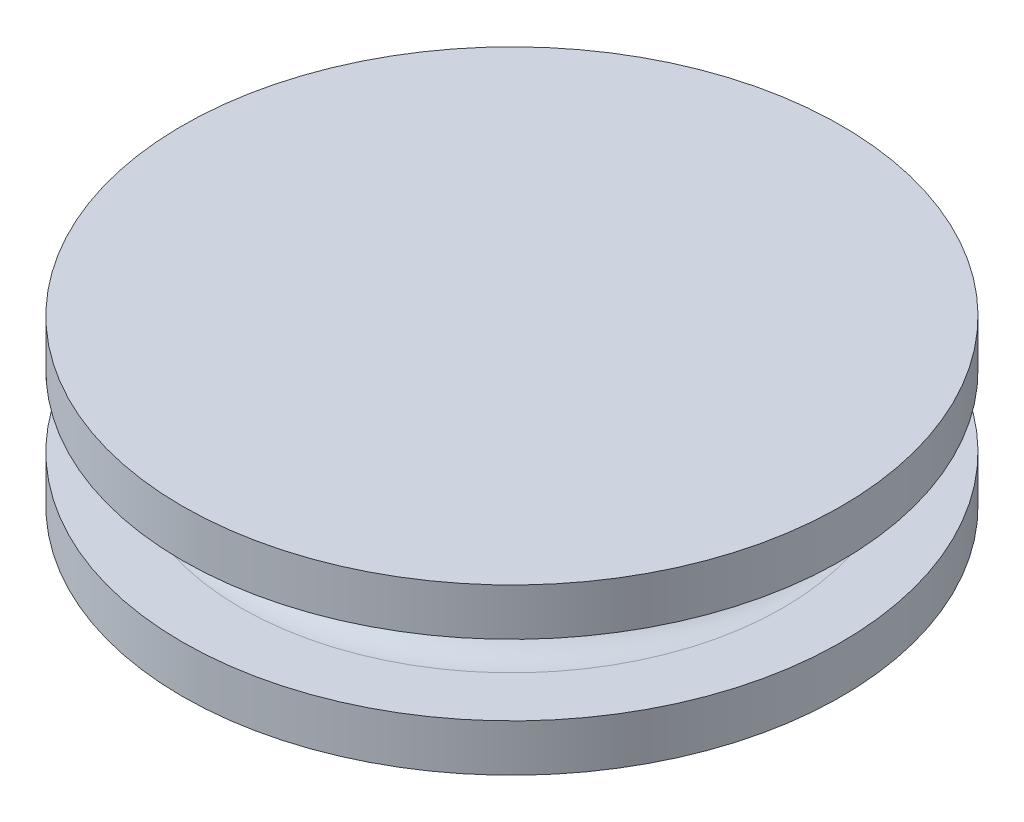
from build123d import *


with BuildPart() as part:
    # ｽｹｯﾁ1 → 回転1 (revolve)
    with BuildSketch(Plane.XY):
        with BuildLine():
            Line((0, 3.5), (-14, 3.5))
            Line((-14, 3.5), (-14, 1.5))
            Line((-14, 1.5), (-11.5, 1.5))
            ThreePointArc((-11.5, 1.5), (-10, 0), (-11.5, -1.5))
            Line((-11.5, -1.5), (-14, -1.5))
            Line((-14, -1.5), (-14, -3.5))
            Line((-14, -3.5), (0, -3.5))
            Line((0, -3.5), (0, 3.5))
        make_face()
    revolve(axis=Axis((0, 3.5, 0), (0, -1, 0)))


solid = part.part
